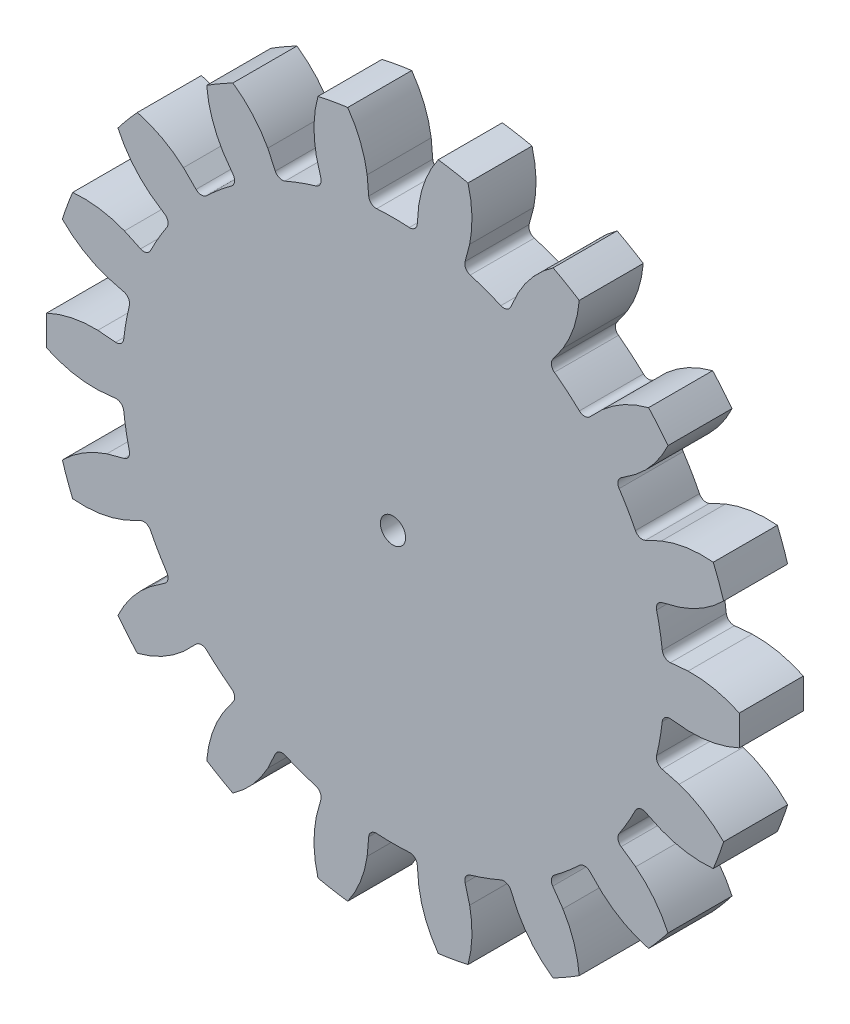
from build123d import *

# Parameters (mm, degrees)
BOSS_EXTRUDE1_DEPTH      = 25.4
FILLET1_R                = 3
CIRPATTERN1_COUNT        = 18
FILLET1_OF_CIRPATTERN1_R = 3
CUT_EXTRUDE1_REACH       = 197.283
SKETCH2_R                = 5


with BuildPart() as part:
    # Sketch1 → Boss-Extrude1 (new body)
    with BuildSketch(Plane.XY):
        with BuildLine():
            ThreePointArc((137.369379585, 5.991957314), (127.462503194, 9.318366761), (117.052877026, 10.240799773))
            Line((117.052877026, 10.240799773), (107.090930045, 9.369242345))
            ThreePointArc((107.090930045, 9.369242345), (106.580322598, 14.031565664), (105.866833449, 18.667179099))
            Line((105.866833449, 18.667179099), (0, 0))
            Line((0, 0), (105.866833449, -18.667179099))
            ThreePointArc((105.866833449, -18.667179099), (106.580322598, -14.031565664), (107.090930045, -9.369242345))
            Line((107.090930045, -9.369242345), (117.052877026, -10.240799773))
            ThreePointArc((117.052877026, -10.240799773), (127.462503194, -9.318366761), (137.369379585, -5.991957314))
            ThreePointArc((137.369379585, -5.991957314), (137.467341018, -2.99669043), (137.5, 0))
            ThreePointArc((137.5, 0), (137.467341018, 2.99669043), (137.369379585, 5.991957314))
        make_face()
    boss_extrude1 = extrude(amount=BOSS_EXTRUDE1_DEPTH)

    # Fillet1
    fillet1_edges = [part.edges().sort_by_distance(p)[0] for p in [
        (107.090930045, 9.369242345, 12.7),
        (107.090930045, -9.369242345, 12.7),
    ]]
    fillet(fillet1_edges, radius=FILLET1_R)

    # CirPattern1: Boss-Extrude1 ×18 about axis
    cirpattern1_axis = Axis((0, 0, 25.4), (0, 0, -1))
    for i in range(1, CIRPATTERN1_COUNT):
        add(boss_extrude1.rotate(cirpattern1_axis, i * 360 / CIRPATTERN1_COUNT))

    # Fillet1 of CirPattern1
    fillet1_of_cirpattern1_edges = [part.edges().sort_by_distance(p)[0] for p in [
        (103.837026326, -27.823047349, 12.7),
        (97.428087106, -45.431463137, 12.7),
        (88.058844761, -61.659466908, 12.7),
        (76.013978978, -76.013978978, 12.7),
        (61.659466908, -88.058844761, 12.7),
        (45.431463137, -97.428087106, 12.7),
        (27.823047349, -103.837026326, 12.7),
        (9.369242345, -107.090930045, 12.7),
        (-9.369242345, -107.090930045, 12.7),
        (-27.823047349, -103.837026326, 12.7),
        (-45.431463137, -97.428087106, 12.7),
        (-61.659466908, -88.058844761, 12.7),
        (-76.013978978, -76.013978978, 12.7),
        (-88.058844761, -61.659466908, 12.7),
        (-97.428087106, -45.431463137, 12.7),
        (-103.837026326, -27.823047349, 12.7),
        (-107.090930045, -9.369242345, 12.7),
        (-107.090930045, 9.369242345, 12.7),
        (-103.837026326, 27.823047349, 12.7),
        (-97.428087106, 45.431463137, 12.7),
        (-88.058844761, 61.659466908, 12.7),
        (-76.013978978, 76.013978978, 12.7),
        (-61.659466908, 88.058844761, 12.7),
        (-45.431463137, 97.428087106, 12.7),
        (-27.823047349, 103.837026326, 12.7),
        (-9.369242345, 107.090930045, 12.7),
        (9.369242345, 107.090930045, 12.7),
        (27.823047349, 103.837026326, 12.7),
        (45.431463137, 97.428087106, 12.7),
        (61.659466908, 88.058844761, 12.7),
        (76.013978978, 76.013978978, 12.7),
        (88.058844761, 61.659466908, 12.7),
        (97.428087106, 45.431463137, 12.7),
        (103.837026326, 27.823047349, 12.7),
    ]]
    fillet(fillet1_of_cirpattern1_edges, radius=FILLET1_OF_CIRPATTERN1_R)

    # Sketch2 → Cut-Extrude1 (cut, up to next)
    with BuildSketch(Plane(origin=(0, 0, 0), x_dir=(-1, 0, 0), z_dir=(0, 0, -1)), mode=Mode.PRIVATE) as cut_extrude1_sk1:
        Circle(SKETCH2_R)
    cut_extrude1_tool1 = extrude(cut_extrude1_sk1.sketch, amount=-CUT_EXTRUDE1_REACH, mode=Mode.PRIVATE) & part.part
    add(cut_extrude1_tool1.solids().sort_by_distance((0, 0, 0))[0], mode=Mode.SUBTRACT)


solid = part.part
